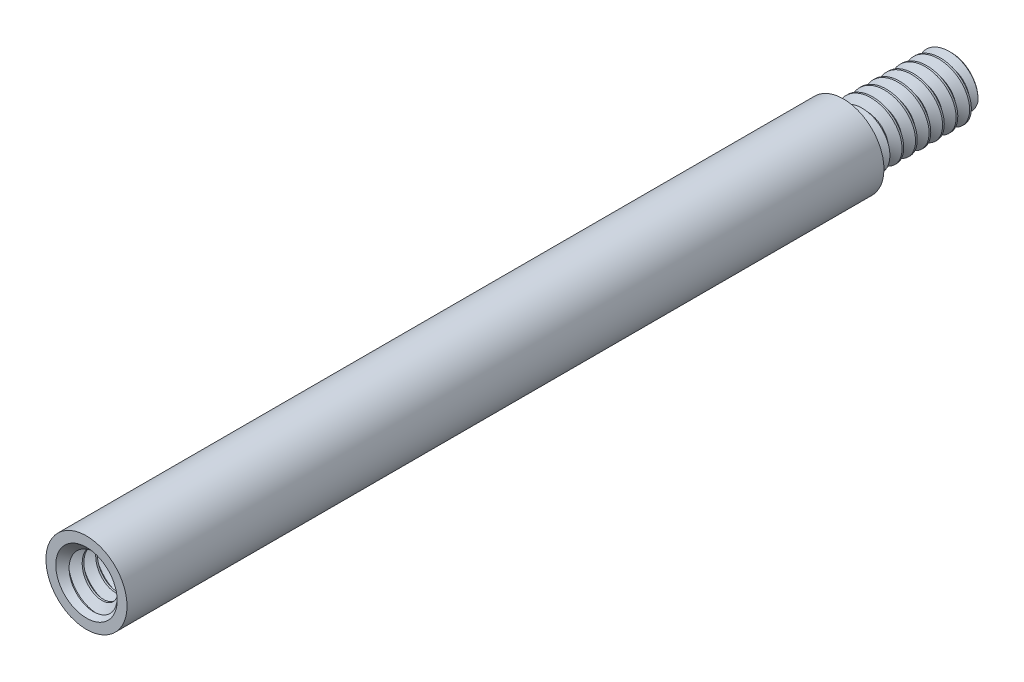
from build123d import *

# Parameters (mm, degrees)
SKETCH4_R              = 2.4638
BOSS_EXTRUDE1_DEPTH    = 44.45
SKETCH5_OUTSIDE_W      = 198.934
SKETCH5_OUTSIDE_H      = 199.916
SKETCH5_OUTSIDE_R      = 3.01625
CUT_EXTRUDE1_DEPTH     = 52.030985277
CUT_EXTRUDE1_DRAFT     = -60
SKETCH6_OUTSIDE_W      = 177.05
SKETCH6_OUTSIDE_H      = 178.032
SKETCH6_OUTSIDE_R      = 3.01625
CUT_EXTRUDE2_DEPTH     = 45.713800536
CUT_EXTRUDE2_DRAFT     = -60
FILLET1_R              = 0.635
CUT_SWEEP1_PITCH       = 0.79375
CUT_SWEEP1_HEIGHT      = 6.1595
CUT_SWEEP1_RADIUS      = 1.7526
CUT_SWEEP1_START_ANGLE = 90
SKETCH9_R              = 1.9510375
BOSS_EXTRUDE2_DEPTH    = 9.525
SKETCH10_W             = 9.525
SKETCH10_H             = 1.7526
CUT_SWEEP2_PITCH       = 0.79375
CUT_SWEEP2_HEIGHT      = 10.31875
CUT_SWEEP2_RADIUS      = 1.7526
CUT_SWEEP2_START_ANGLE = 90
SKETCH14_R             = 6.471745381
SKETCH14_R_2           = 3.01625
SKETCH14_R_3           = 2.38125
CUT_EXTRUDE4_DEPTH     = 52.024022066


with BuildPart() as part:
    # Sketch3 → Revolve1 (revolve)
    with BuildSketch(Plane(origin=(0, 0, 0), x_dir=(0, 0, -1), z_dir=(1, 0, 0))):
        with BuildLine():
            Line((-34.925, 1.5541625), (-34.925, 0))
            Line((-34.925, 0), (6.35, 0))
            Line((6.35, 0), (6.35, 1.5541625))
            Line((6.35, 1.5541625), (6.1515625, 1.7526))
            Line((6.1515625, 1.7526), (1.05965625, 1.7526))
            Line((1.05965625, 1.7526), (0.762, 1.237044252))
            Line((0.762, 1.237044252), (0.1984375, 1.237044252))
            ThreePointArc((0.1984375, 1.237044252), (0.058120998, 1.29516525), (0, 1.435481752))
            Line((0, 1.435481752), (0, 3.175))
            Line((0, 3.175), (-44.45, 3.175))
            Line((-44.45, 3.175), (-44.45, 1.9510375))
            Line((-44.45, 1.9510375), (-44.2515625, 1.7526))
            Line((-44.2515625, 1.7526), (-35.1234375, 1.7526))
            Line((-35.1234375, 1.7526), (-34.925, 1.5541625))
        make_face()
    revolve(axis=Axis((0, 0, -6.35), (0, 0, 1)))

    # Sketch4 → Boss-Extrude1 (add)
    with BuildSketch(Plane.XY.offset(44.45)):
        Polygon((-3.175, 1.833087105), (-3.175, -1.833087105), (0, -3.666174209), (3.175, -1.833087105), (3.175, 1.833087105), (0, 3.666174209), align=None)
        Circle(SKETCH4_R, mode=Mode.SUBTRACT)
    extrude(amount=-BOSS_EXTRUDE1_DEPTH)


with BuildPart() as cut_extrude1_tool:
    # Sketch5 outside → Cut-Extrude1 (with draft: the straight prism first)
    with BuildSketch(Plane.XY.offset(44.45)):
        Rectangle(SKETCH5_OUTSIDE_W, SKETCH5_OUTSIDE_H)
        Circle(SKETCH5_OUTSIDE_R, mode=Mode.SUBTRACT)
    extrude(amount=-CUT_EXTRUDE1_DEPTH)
    # Cut-Extrude1: the draft: its side faces are tilted about the plane it starts from
    cut_extrude1_sides = [cut_extrude1_tool.faces().sort_by_distance(p)[0] for p in [
        (0, -99.958, 18.434507362),
        (99.467, 0, 18.434507362),
        (0, 99.958, 18.434507362),
        (-99.467, 0, 18.434507362),
        (-3.01625, 0, 18.434507362),
    ]]
    draft(cut_extrude1_sides, Plane.XY.offset(44.45), CUT_EXTRUDE1_DRAFT)


with BuildPart() as part_1:
    add(part.part)

    # Cut-Extrude1: cut by cut_extrude1_tool
    add(cut_extrude1_tool.part, mode=Mode.SUBTRACT)


with BuildPart() as cut_extrude2_tool:
    # Sketch6 outside → Cut-Extrude2 (with draft: the straight prism first)
    with BuildSketch(Plane(origin=(0, 0, 0), x_dir=(-1, 0, 0), z_dir=(0, 0, -1))):
        Rectangle(SKETCH6_OUTSIDE_W, SKETCH6_OUTSIDE_H)
        Circle(SKETCH6_OUTSIDE_R, mode=Mode.SUBTRACT)
    extrude(amount=-CUT_EXTRUDE2_DEPTH)
    # Cut-Extrude2: the draft: its side faces are tilted about the plane it starts from
    cut_extrude2_sides = [cut_extrude2_tool.faces().sort_by_distance(p)[0] for p in [
        (0, -89.016, 22.856900268),
        (-88.525, 0, 22.856900268),
        (0, 89.016, 22.856900268),
        (88.525, 0, 22.856900268),
        (3.01625, 0, 22.856900268),
    ]]
    draft(cut_extrude2_sides, Plane(origin=(0, 0, 0), x_dir=(-1, 0, 0), z_dir=(0, 0, -1)), CUT_EXTRUDE2_DRAFT)


with BuildPart() as part_2:
    add(part_1.part)

    # Cut-Extrude2: cut by cut_extrude2_tool
    add(cut_extrude2_tool.part, mode=Mode.SUBTRACT)

    # Fillet1
    fillet1_edges = [part_2.edges().sort_by_distance(p)[0] for p in [
        (0, 3.666174209, 22.225),
        (-3.175, -1.833087105, 22.225),
        (0, -3.666174209, 22.225),
        (3.175, -1.833087105, 22.225),
        (3.175, 1.833087105, 22.225),
        (-3.175, 1.833087105, 22.225),
    ]]
    fillet(fillet1_edges, radius=FILLET1_R)

    # Cut-Sweep1: sweep along a helix
    with BuildLine() as cut_sweep1_path:
        add(Helix(CUT_SWEEP1_PITCH, CUT_SWEEP1_HEIGHT, CUT_SWEEP1_RADIUS, center=(0, 0, -6.35), direction=(0, 0, 1), mode=Mode.PRIVATE).rotate(Axis((0, 0, -6.35), (0, 0, 1)), CUT_SWEEP1_START_ANGLE))
    # Sketch7 → Cut-Sweep1 (sweep, cut)
    with BuildSketch(Plane.ZY):
        Polygon((-6.64765625, 1.237044252), (-6.746875, 1.237044252), (-7.069335938, 1.795562979), (-6.325195312, 1.795562979), align=None)
    sweep(path=cut_sweep1_path.line, is_frenet=True, mode=Mode.SUBTRACT)

    # Sketch9 → Boss-Extrude2 (add)
    with BuildSketch(Plane.XY.offset(34.925)):
        Circle(SKETCH9_R)
    extrude(amount=BOSS_EXTRUDE2_DEPTH)


with BuildPart() as body_2:
    # Sketch10 → Revolve2 (revolve)
    with BuildSketch(Plane(origin=(0, 0, 0), x_dir=(0, 0, -1), z_dir=(1, 0, 0))):
        with Locations((-39.6875, 0.8763)):
            Rectangle(SKETCH10_W, SKETCH10_H)
    revolve(axis=Axis((0, 0, -6.35), (0, 0, 1)))

    # Cut-Sweep2: sweep along a helix
    with BuildLine() as cut_sweep2_path:
        add(Helix(CUT_SWEEP2_PITCH, CUT_SWEEP2_HEIGHT, CUT_SWEEP2_RADIUS, center=(0, 0, 44.45), direction=(0, 0, -1), mode=Mode.PRIVATE).rotate(Axis((0, 0, 44.45), (0, 0, -1)), CUT_SWEEP2_START_ANGLE))
    # Sketch12 → Cut-Sweep2 (sweep, cut)
    with BuildSketch(Plane(origin=(0, 0, 0), x_dir=(0, 0, -1), z_dir=(1, 0, 0))):
        Polygon((-44.846875, 1.237044252), (-44.74765625, 1.237044252), (-44.425195313, 1.795562979), (-45.169335938, 1.795562979), align=None)
    sweep(path=cut_sweep2_path.line, is_frenet=True, mode=Mode.SUBTRACT)


with BuildPart() as part_3:
    add(part_2.part)

    # Combine1: cut body 2
    add(body_2.part, mode=Mode.SUBTRACT)

    # Cut-Extrude3 cone 1 section (through the dimple's axis) → Cut-Extrude3 (revolve, cut)
    with BuildSketch(Plane(origin=(0, 0, 44.45), x_dir=(0, -1, 0), z_dir=(1, 0, 0))):
        Polygon((0, 0), (1.8034, 0), (0, 1.8034), align=None)
    revolve(axis=Axis((0, 0, 44.45), (0, 0, -1)), mode=Mode.SUBTRACT)

    # Sketch14 → Cut-Extrude4 (cut, through all)
    # profile 1 of 2: a face of its own
    with BuildSketch(Plane.XY.offset(44.45)):
        Circle(SKETCH14_R)
        Circle(SKETCH14_R_2, mode=Mode.SUBTRACT)
    # profile 2 of 2: a face of its own
    with BuildSketch(Plane.XY.offset(44.45)):
        Circle(SKETCH14_R_2)
        Circle(SKETCH14_R_3, mode=Mode.SUBTRACT)
    extrude(amount=-CUT_EXTRUDE4_DEPTH, mode=Mode.SUBTRACT)


solid = part_3.part
